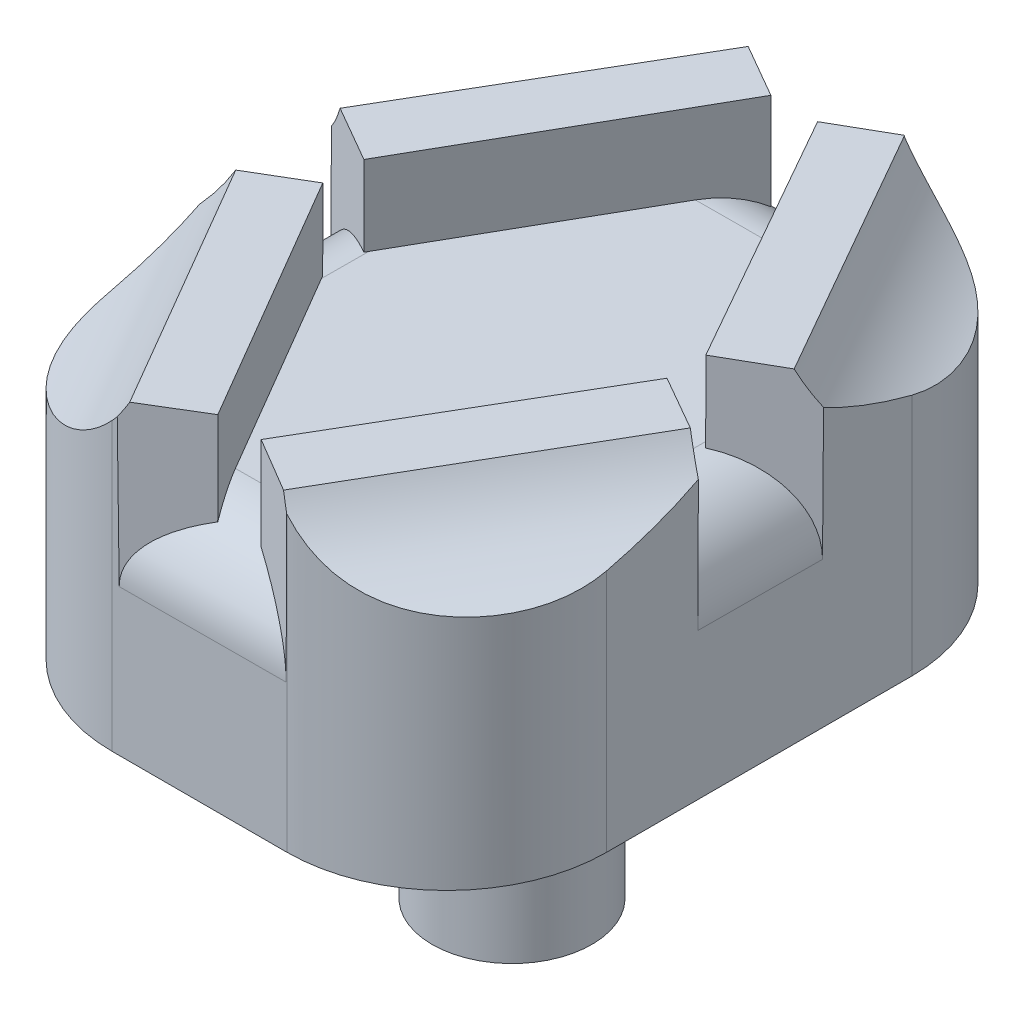
from build123d import *

# Parameters (mm, degrees)
SKETCH1_R           = 5
BOSS_EXTRUDE1_DEPTH = 15
BOSS_EXTRUDE2_REACH = 18.583
SKETCH3_W           = 30.927843762
SKETCH3_H           = 39.089679092
BOSS_EXTRUDE3_DEPTH = 5
FILLET3_R           = 10
FILLET4_R           = 10
FILLET5_R           = 5


with BuildPart() as part:
    # Sketch1 → Boss-Extrude1 (new body)
    with BuildSketch(Plane(origin=(0, 0, 0), x_dir=(1, 0, 0), z_dir=(0, 1, 0))):
        with Locations(Location((0, 0, 0), (0, 0, 270))):
            Circle(SKETCH1_R)
    extrude(amount=BOSS_EXTRUDE1_DEPTH)

    # Boss-Extrude2: up to this plane
    boss_extrude2_end = Plane(origin=(-9.846603066, 29.165234705, 22.263489811), z_dir=(0.00455125846969128, -0.999975636016732, 0.005292770472472197))
    # Sketch3 → Boss-Extrude2 (add, up to the surface)
    with BuildSketch(Plane(origin=(0, 15, 0), x_dir=(0.9999999999274632, 0, -1.2044654693728269e-05), z_dir=(0, 1, 0)), mode=Mode.PRIVATE) as boss_extrude2_sk1:
        Rectangle(SKETCH3_W, SKETCH3_H)
    boss_extrude2_tool1 = split(extrude(boss_extrude2_sk1.sketch, amount=BOSS_EXTRUDE2_REACH, mode=Mode.PRIVATE), bisect_by=boss_extrude2_end, keep=Keep.BOTH, mode=Mode.PRIVATE)
    add(boss_extrude2_tool1.solids().sort_by_distance((0, 15, 0))[0])

    # Sketch4 → Boss-Extrude3 (add)
    with BuildSketch(Plane(origin=(-0.13240295, 29.090794233, -0.153974648), x_dir=(0.999989642969537, 0.004551194719768432, -2.408901593164283e-05), z_dir=(-0.00455125846969128, 0.9999756360167321, -0.005292770472472199))):
        Polygon((-10.468446008, 1.179056561), (-14.015647607, 3.23739849), (-4.642053476, 19.39119083), (-1.261524033, 17.429564094), align=None)
        Polygon((1.642950919, 17.449824818), (10.918190552, 1.179056561), (14.439586423, 3.186447364), (5.10941674, 19.425902448), align=None)
        Polygon((-4.509809714, -19.426615257), (-1.0720352, -17.35621268), (-10.468446008, -1.392474744), (-13.897089917, -3.410607765), align=None)
        Polygon((1.642950919, -17.359692849), (5.10941674, -19.426615257), (14.418460095, -3.291199551), (10.971474425, -1.302521996), align=None)
    extrude(amount=BOSS_EXTRUDE3_DEPTH)

    # Fillet3
    # the kernel refuses this fillet: 10 mm, written as the material it adds along each edge
    with BuildSketch(Plane(origin=(-14.147905396, 29.009871307, -3.390990168), x_dir=(-0.8649200924486613, -0.00659289857656894, -0.5018662843496846), z_dir=(0.501888951586844, -0.0022937003490612054, -0.8649290255354872))) as fillet3_piece_1_section:
        with BuildLine():
            CenterArc((8.660254038, 10), FILLET3_R, 210, 60)
            Line((0, 5), (0, 0))
            Line((0, 0), (8.660254038, 0))
        make_face()
    fillet3_piece_1 = extrude(amount=40.327071422, mode=Mode.PRIVATE)
    fillet3_piece_1 = split(fillet3_piece_1, bisect_by=Plane(origin=(-14.148099961, 29.009871307, -19.544669139), z_dir=(1.2044654693728269e-05, 0, 0.9999999999274632)), keep=Keep.TOP, mode=Mode.PRIVATE)
    fillet3_piece_1 = split(fillet3_piece_1, bisect_by=Plane(origin=(-15.463962725, 29.009871307, -3.390974317), z_dir=(0.9999999999274632, 0, -1.2044654693728269e-05)), keep=Keep.TOP, mode=Mode.PRIVATE)
    add(fillet3_piece_1)
    with BuildSketch(Plane(origin=(25.092607476, 29.288095335, 15.431577947), x_dir=(0.8670707080024372, 0.0013095245658877922, -0.4981833723334847), z_dir=(-0.4981643035891815, -0.006856567533653001, -0.8670555426909873))) as fillet3_piece_2_section:
        with BuildLine():
            CenterArc((8.660254038, -10), FILLET3_R, 90, 60)
            Line((0, -5), (0, 0))
            Line((0, 0), (8.660254038, 0))
        make_face()
    fillet3_piece_2 = extrude(amount=61.99000894, mode=Mode.PRIVATE)
    fillet3_piece_2 = split(fillet3_piece_2, bisect_by=Plane(origin=(25.092186194, 29.288095335, -19.545141774), z_dir=(1.2044654693728269e-05, 0, 0.9999999999274632)), keep=Keep.TOP, mode=Mode.PRIVATE)
    fillet3_piece_2 = split(fillet3_piece_2, bisect_by=Plane(origin=(15.464107751, 29.288095335, 15.431693919), z_dir=(-0.9999999999274632, 0, 1.2044654693728269e-05)), keep=Keep.TOP, mode=Mode.PRIVATE)
    fillet3_piece_2 = split(fillet3_piece_2, bisect_by=Plane(origin=(14.370532456, 29.1397437, -3.376924296), z_dir=(-0.4952342540982205, -0.006852107536017414, -0.8687324571984713)), keep=Keep.TOP, mode=Mode.PRIVATE)
    add(fillet3_piece_2)
    with BuildSketch(Plane(origin=(-5.84236608, 29.266886921, 38.025636113), x_dir=(0.8661731369644169, 0.006587138984293146, 0.49970061677090505), z_dir=(0.49972330628815326, -0.0023101889389853464, -0.8661820133086942))) as fillet3_piece_3_section:
        with BuildLine():
            CenterArc((8.660254038, -10), FILLET3_R, 90, 60)
            Line((0, -5), (0, 0))
            Line((0, 0), (8.660254038, 0))
        make_face()
    fillet3_piece_3 = extrude(amount=40.27883759, mode=Mode.PRIVATE)
    fillet3_piece_3 = split(fillet3_piece_3, bisect_by=Plane(origin=(15.464379885, 29.266886921, 38.02537948), z_dir=(-0.9999999999274632, 0, 1.2044654693728269e-05)), keep=Keep.TOP, mode=Mode.PRIVATE)
    fillet3_piece_3 = split(fillet3_piece_3, bisect_by=Plane(origin=(-5.842588674, 29.266886921, 19.54490992), z_dir=(-1.2044654693728269e-05, 0, -0.9999999999274632)), keep=Keep.TOP, mode=Mode.PRIVATE)
    fillet3_piece_3 = split(fillet3_piece_3, bisect_by=Plane(origin=(5.244381098, 29.218930921, 19.431690955), z_dir=(0.5121278759381178, -0.0022152218479130122, -0.8589063578058298)), keep=Keep.TOP, mode=Mode.PRIVATE)
    add(fillet3_piece_3)
    with BuildSketch(Plane(origin=(-24.977156683, 28.89690852, -15.421232823), x_dir=(-0.8627222599150277, -0.0012500727128449166, 0.5056765167232111), z_dir=(0.5056575800810756, 0.006867655432883244, 0.8627069299683444))) as fillet3_piece_4_section:
        with BuildLine():
            CenterArc((8.660254038, -10), FILLET3_R, 90, 60)
            Line((0, -5), (0, 0))
            Line((0, 0), (8.660254038, 0))
        make_face()
    fillet3_piece_4 = extrude(amount=61.865578029, mode=Mode.PRIVATE)
    fillet3_piece_4 = split(fillet3_piece_4, bisect_by=Plane(origin=(-15.464107627, 28.89690852, -15.421347404), z_dir=(0.9999999999274632, 0, -1.2044654693728269e-05)), keep=Keep.TOP, mode=Mode.PRIVATE)
    fillet3_piece_4 = split(fillet3_piece_4, bisect_by=Plane(origin=(-24.976735525, 28.89690852, 19.545140384), z_dir=(-1.2044654693728269e-05, 0, -0.9999999999274632)), keep=Keep.TOP, mode=Mode.PRIVATE)
    fillet3_piece_4 = split(fillet3_piece_4, bisect_by=Plane(origin=(-13.994792141, 29.045647238, 3.236578891), z_dir=(0.5072545599631075, 0.006869958912506911, 0.8617688872668674)), keep=Keep.TOP, mode=Mode.PRIVATE)
    fillet3_piece_4 = split(fillet3_piece_4, bisect_by=Plane(origin=(-4.231441732, 29.173650955, 19.025109137), z_dir=(-0.5159074727393343, -0.006882071338550758, -0.8566166684496653)), keep=Keep.TOP, mode=Mode.PRIVATE)
    add(fillet3_piece_4)

    # Fillet4
    fillet4_edges = [part.edges().sort_by_distance(p)[0] for p in [
        (15.463686469, 22.029571456, -19.545025802),
        (-15.464157291, 21.959190422, -19.544653287),
        (-15.463686469, 22.062640363, 19.545025802),
        (15.464157291, 22.133021398, 19.544653287),
    ]]
    fillet(fillet4_edges, radius=FILLET4_R)

    # Fillet5
    # the kernel refuses this fillet: 5 mm, written as the material it takes off along each edge
    with BuildSketch(Plane(origin=(-15.464121796, 28.933978949, -16.597696934), x_dir=(6.375187728904126e-08, -0.9999859926119807, 0.00529288010702584), z_dir=(1.2044485979576416e-05, 0.005292880107409781, 0.999985992539445))) as fillet5_piece_1_section:
        with BuildLine():
            CenterArc((FILLET5_R * 0.995459114993, FILLET5_R), FILLET5_R, 180.260765149, 89.739234851)
            Line((-FILLET5_R * 0.00453052826693, FILLET5_R * 0.99544880528), (0, 0))
            Line((0, 0), (FILLET5_R * 0.995459114992, 0))
        make_face()
    fillet5_piece_1 = extrude(amount=33.142551861, mode=Mode.PRIVATE)
    fillet5_piece_1 = split(fillet5_piece_1, bisect_by=Plane(origin=(-6.415383651, 29.056529763, -1.224900675), z_dir=(-0.507254559962968, -0.006869958912999567, -0.8617688872669456)), keep=Keep.TOP, mode=Mode.PRIVATE)
    fillet5_piece_1 = split(fillet5_piece_1, bisect_by=Plane(origin=(-5.235440397, 29.011205363, -10.802781085), z_dir=(0.8700521889032995, 0.006568882911342859, 0.4929158532263639)), keep=Keep.TOP, mode=Mode.PRIVATE)
    add(fillet5_piece_1, mode=Mode.SUBTRACT)
    with BuildSketch(Plane(origin=(-15.464121796, 28.933978949, -16.597696934), x_dir=(6.375187728904126e-08, -0.9999859926119807, 0.00529288010702584), z_dir=(1.2044485979576416e-05, 0.005292880107409781, 0.999985992539445))) as fillet5_piece_2_section:
        with BuildLine():
            CenterArc((FILLET5_R * 0.995459114993, FILLET5_R), FILLET5_R, 180.260765149, 89.739234851)
            Line((-FILLET5_R * 0.00453052826693, FILLET5_R * 0.99544880528), (0, 0))
            Line((0, 0), (FILLET5_R * 0.995459114992, 0))
        make_face()
    fillet5_piece_2 = extrude(amount=33.142551861, mode=Mode.PRIVATE)
    fillet5_piece_2 = split(fillet5_piece_2, bisect_by=Plane(origin=(-20.86567334, 28.95866477, -7.288947062), z_dir=(-0.5018889515871722, 0.002293700349000787, 0.8649290255352967)), keep=Keep.TOP, mode=Mode.PRIVATE)
    fillet5_piece_2 = split(fillet5_piece_2, bisect_by=Plane(origin=(-19.64947868, 28.927969608, -14.134063493), z_dir=(0.8617842522597962, 0.0012373509900901443, -0.507273468180183)), keep=Keep.TOP, mode=Mode.PRIVATE)
    add(fillet5_piece_2, mode=Mode.SUBTRACT)
    with BuildSketch(Plane(origin=(-15.464121796, 28.933978949, -16.597696934), x_dir=(6.375187728904126e-08, -0.9999859926119807, 0.00529288010702584), z_dir=(1.2044485979576416e-05, 0.005292880107409781, 0.999985992539445))) as fillet5_piece_3_section:
        with BuildLine():
            CenterArc((FILLET5_R * 0.995459114993, FILLET5_R), FILLET5_R, 180.260765149, 89.739234851)
            Line((-FILLET5_R * 0.00453052826693, FILLET5_R * 0.99544880528), (0, 0))
            Line((0, 0), (FILLET5_R * 0.995459114992, 0))
        make_face()
    fillet5_piece_3 = extrude(amount=33.142551861, mode=Mode.PRIVATE)
    fillet5_piece_3 = split(fillet5_piece_3, bisect_by=Plane(origin=(-6.415383651, 29.056529763, -1.224900675), z_dir=(-0.507254559962968, -0.006869958912999567, -0.8617688872669456)), keep=Keep.TOP, mode=Mode.PRIVATE)
    fillet5_piece_3 = split(fillet5_piece_3, bisect_by=Plane(origin=(-20.86567334, 28.95866477, -7.288947062), z_dir=(-0.5018889515871722, 0.002293700349000787, 0.8649290255352967)), keep=Keep.TOP, mode=Mode.PRIVATE)
    add(fillet5_piece_3, mode=Mode.SUBTRACT)
    with BuildSketch(Plane(origin=(17.349750172, 29.067726965, -19.545048519), x_dir=(-1.2044529946827532e-05, 0.005292770472472884, 0.9999859931197312), z_dir=(-0.9999896428970009, -0.00455125846969128, 1.2044529946872691e-05))) as fillet5_piece_4_section:
        with BuildLine():
            CenterArc((FILLET5_R * 0.994721107865, -FILLET5_R), FILLET5_R, 90, 89.696742033)
            Line((-FILLET5_R * 0.00526488503663, -FILLET5_R * 0.99470717471), (0, 0))
            Line((0, 0), (FILLET5_R * 0.994721107865, 0))
        make_face()
    fillet5_piece_4 = extrude(amount=34.558401512, mode=Mode.PRIVATE)
    fillet5_piece_4 = split(fillet5_piece_4, bisect_by=Plane(origin=(14.300125636, 29.025532074, -24.894653871), z_dir=(-0.49523425409822125, -0.006852107536017416, -0.8687324571984709)), keep=Keep.TOP, mode=Mode.PRIVATE)
    fillet5_piece_4 = split(fillet5_piece_4, bisect_by=Plane(origin=(4.001876218, 28.966950687, -27.107099121), z_dir=(0.8700521889032995, 0.006568882911342859, 0.4929158532263639)), keep=Keep.TOP, mode=Mode.PRIVATE)
    add(fillet5_piece_4, mode=Mode.SUBTRACT)
    with BuildSketch(Plane(origin=(17.349750172, 29.067726965, -19.545048519), x_dir=(-1.2044529946827532e-05, 0.005292770472472884, 0.9999859931197312), z_dir=(-0.9999896428970009, -0.00455125846969128, 1.2044529946872691e-05))) as fillet5_piece_5_section:
        with BuildLine():
            CenterArc((FILLET5_R * 0.994721107865, -FILLET5_R), FILLET5_R, 90, 89.696742033)
            Line((-FILLET5_R * 0.00526488503663, -FILLET5_R * 0.99470717471), (0, 0))
            Line((0, 0), (FILLET5_R * 0.994721107865, 0))
        make_face()
    fillet5_piece_5 = extrude(amount=34.558401512, mode=Mode.PRIVATE)
    fillet5_piece_5 = split(fillet5_piece_5, bisect_by=Plane(origin=(11.776840375, 29.093195916, -9.940988847), z_dir=(0.5018889515868442, -0.002293700349061202, -0.8649290255354869)), keep=Keep.TOP, mode=Mode.PRIVATE)
    fillet5_piece_5 = split(fillet5_piece_5, bisect_by=Plane(origin=(4.560155488, 29.048107639, -12.25398927), z_dir=(-0.868747558047861, -0.0013326647166724062, 0.4952533739315984)), keep=Keep.TOP, mode=Mode.PRIVATE)
    add(fillet5_piece_5, mode=Mode.SUBTRACT)
    with BuildSketch(Plane(origin=(17.349750172, 29.067726965, -19.545048519), x_dir=(-1.2044529946827532e-05, 0.005292770472472884, 0.9999859931197312), z_dir=(-0.9999896428970009, -0.00455125846969128, 1.2044529946872691e-05))) as fillet5_piece_6_section:
        with BuildLine():
            CenterArc((FILLET5_R * 0.994721107865, -FILLET5_R), FILLET5_R, 90, 89.696742033)
            Line((-FILLET5_R * 0.00526488503663, -FILLET5_R * 0.99470717471), (0, 0))
            Line((0, 0), (FILLET5_R * 0.994721107865, 0))
        make_face()
    fillet5_piece_6 = extrude(amount=34.558401512, mode=Mode.PRIVATE)
    fillet5_piece_6 = split(fillet5_piece_6, bisect_by=Plane(origin=(4.560155488, 29.048107639, -12.25398927), z_dir=(-0.868747558047861, -0.0013326647166724062, 0.4952533739315984)), keep=Keep.TOP, mode=Mode.PRIVATE)
    fillet5_piece_6 = split(fillet5_piece_6, bisect_by=Plane(origin=(4.001876218, 28.966950687, -27.107099121), z_dir=(0.8700521889032995, 0.006568882911342859, 0.4929158532263639)), keep=Keep.TOP, mode=Mode.PRIVATE)
    add(fillet5_piece_6, mode=Mode.SUBTRACT)
    with BuildSketch(Plane(origin=(15.464119093, 29.249256998, 16.373305657), x_dir=(-0.9999896428970014, -0.004551130969418724, 3.613345794583441e-05), z_dir=(-1.2044485979576416e-05, -0.005292880107409781, -0.999985992539445))) as fillet5_piece_7_section:
        with BuildLine():
            CenterArc((FILLET5_R * 1.00456159871, -FILLET5_R), FILLET5_R, 90, 90.260765149)
            Line((FILLET5_R * 0.00457195544606, -FILLET5_R * 1.00455119472), (0, 0))
            Line((0, 0), (FILLET5_R * 1.00456159871, 0))
        make_face()
    fillet5_piece_7 = extrude(amount=32.930824487, mode=Mode.PRIVATE)
    fillet5_piece_7 = split(fillet5_piece_7, bisect_by=Plane(origin=(6.698473906, 29.12797471, 0.996743114), z_dir=(0.495234254098257, 0.006852107536003555, 0.8687324571984507)), keep=Keep.TOP, mode=Mode.PRIVATE)
    fillet5_piece_7 = split(fillet5_piece_7, bisect_by=Plane(origin=(20.899404838, 29.224130019, 6.952198636), z_dir=(0.49972330628790584, -0.002310188938999564, -0.8661820133088368)), keep=Keep.TOP, mode=Mode.PRIVATE)
    add(fillet5_piece_7, mode=Mode.SUBTRACT)
    with BuildSketch(Plane(origin=(15.464119093, 29.249256998, 16.373305657), x_dir=(-0.9999896428970014, -0.004551130969418724, 3.613345794583441e-05), z_dir=(-1.2044485979576416e-05, -0.005292880107409781, -0.999985992539445))) as fillet5_piece_8_section:
        with BuildLine():
            CenterArc((FILLET5_R * 1.00456159871, -FILLET5_R), FILLET5_R, 90, 90.260765149)
            Line((FILLET5_R * 0.00457195544606, -FILLET5_R * 1.00455119472), (0, 0))
            Line((0, 0), (FILLET5_R * 1.00456159871, 0))
        make_face()
    fillet5_piece_8 = extrude(amount=32.930824487, mode=Mode.PRIVATE)
    fillet5_piece_8 = split(fillet5_piece_8, bisect_by=Plane(origin=(19.551319708, 29.255526792, 14.043284841), z_dir=(-0.868747558047861, -0.0013326647166724062, 0.4952533739315984)), keep=Keep.TOP, mode=Mode.PRIVATE)
    fillet5_piece_8 = split(fillet5_piece_8, bisect_by=Plane(origin=(5.392911116, 29.172452185, 10.522632292), z_dir=(-0.8646629334649698, -0.0065940724447949885, -0.5023091973081381)), keep=Keep.TOP, mode=Mode.PRIVATE)
    add(fillet5_piece_8, mode=Mode.SUBTRACT)
    with BuildSketch(Plane(origin=(-17.660698405, 29.115281454, 19.545052265), x_dir=(0.004551258469361128, -0.9999896429695371, -5.481978292389559e-08), z_dir=(0.9999896428970009, 0.00455125846969128, -1.2044529946872691e-05))) as fillet5_piece_9_section:
        with BuildLine():
            CenterArc((FILLET5_R * 1.00530690672, FILLET5_R), FILLET5_R, 179.696742033, 90.303257967)
            Line((FILLET5_R * 0.00532091382199, FILLET5_R * 1.00529282529), (0, 0))
            Line((0, 0), (FILLET5_R * 1.00530690672, 0))
        make_face()
    fillet5_piece_9 = extrude(amount=35.66131678, mode=Mode.PRIVATE)
    fillet5_piece_9 = split(fillet5_piece_9, bisect_by=Plane(origin=(-4.414737867, 29.134300022, 11.748060936), z_dir=(0.8617842522597962, 0.0012373509900901443, -0.507273468180183)), keep=Keep.TOP, mode=Mode.PRIVATE)
    fillet5_piece_9 = split(fillet5_piece_9, bisect_by=Plane(origin=(-4.343216894, 29.216842923, 27.281585414), z_dir=(-0.8646629334649698, -0.0065940724447949885, -0.5023091973081381)), keep=Keep.TOP, mode=Mode.PRIVATE)
    add(fillet5_piece_9, mode=Mode.SUBTRACT)
    with BuildSketch(Plane(origin=(-17.660698405, 29.115281454, 19.545052265), x_dir=(0.004551258469361128, -0.9999896429695371, -5.481978292389559e-08), z_dir=(0.9999896428970009, 0.00455125846969128, -1.2044529946872691e-05))) as fillet5_piece_10_section:
        with BuildLine():
            CenterArc((FILLET5_R * 1.00530690672, FILLET5_R), FILLET5_R, 179.696742033, 90.303257967)
            Line((FILLET5_R * 0.00532091382199, FILLET5_R * 1.00529282529), (0, 0))
            Line((0, 0), (FILLET5_R * 1.00530690672, 0))
        make_face()
    fillet5_piece_10 = extrude(amount=35.66131678, mode=Mode.PRIVATE)
    fillet5_piece_10 = split(fillet5_piece_10, bisect_by=Plane(origin=(-14.315934254, 29.159899737, 25.098723951), z_dir=(0.5159074727389396, 0.006882071338999195, 0.8566166684498997)), keep=Keep.TOP, mode=Mode.PRIVATE)
    fillet5_piece_10 = split(fillet5_piece_10, bisect_by=Plane(origin=(-11.603522926, 29.089080991, 9.386365784), z_dir=(-0.5121278759379562, 0.00221522184799981, 0.8589063578059263)), keep=Keep.TOP, mode=Mode.PRIVATE)
    add(fillet5_piece_10, mode=Mode.SUBTRACT)


solid = part.part
